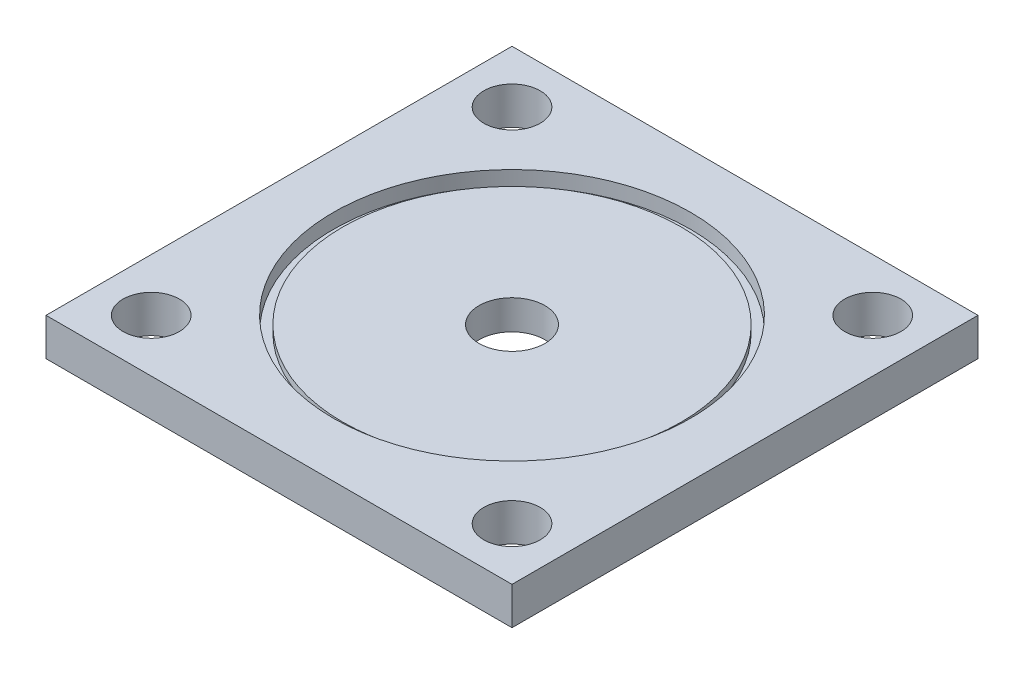
from build123d import *

# Parameters (mm, degrees)
PLATEOUTLINE_W      = 78.74
PLATEOUTLINE_H      = 78.74
BOSS_EXTRUDE1_DEPTH = 6.35
RAILGUIDES_R        = 4.7625
CUT_EXTRUDE1_DEPTH  = 10
CUT_EXTRUDE2_START  = 5
FUELGRAINMOUNTING_R = 30.1625
CUT_EXTRUDE2_DEPTH  = 5
GASINTAKE_R         = 5.55625
CUT_EXTRUDE3_DEPTH  = 5
CUT_EXTRUDE4_START  = 3.857
SKETCH1_R           = 30.1625
SKETCH1_R_2         = 28.575
CUT_EXTRUDE4_DEPTH  = 1.143


with BuildPart() as part:
    # plateOutline → Boss-Extrude1 (new body)
    with BuildSketch(Plane(origin=(0, 0, 0), x_dir=(1, 0, 0), z_dir=(0, 1, 0))):
        Rectangle(PLATEOUTLINE_W, PLATEOUTLINE_H)
    extrude(amount=BOSS_EXTRUDE1_DEPTH)

    # railGuides → Cut-Extrude1 (cut)
    with BuildSketch(Plane(origin=(0, 0, 0), x_dir=(1, 0, 0), z_dir=(0, 1, 0))):
        with Locations((-30.48, 30.48)):
            Circle(RAILGUIDES_R)
        with Locations((30.48, 30.48)):
            Circle(RAILGUIDES_R)
        with Locations((30.48, -30.48)):
            Circle(RAILGUIDES_R)
        with Locations((-30.48, -30.48)):
            Circle(RAILGUIDES_R)
    extrude(amount=CUT_EXTRUDE1_DEPTH, mode=Mode.SUBTRACT)

    # FuelGrainMounting → Cut-Extrude2 (cut)
    with BuildSketch(Plane(origin=(0, 0, 0), x_dir=(1, 0, 0), z_dir=(0, 1, 0)).offset(CUT_EXTRUDE2_START)):
        Circle(FUELGRAINMOUNTING_R)
    extrude(amount=CUT_EXTRUDE2_DEPTH, mode=Mode.SUBTRACT)

    # GasIntake → Cut-Extrude3 (cut)
    with BuildSketch(Plane(origin=(0, 0, 0), x_dir=(1, 0, 0), z_dir=(0, 1, 0))):
        Circle(GASINTAKE_R)
    extrude(amount=CUT_EXTRUDE3_DEPTH, mode=Mode.SUBTRACT)

    # Sketch1 → Cut-Extrude4 (cut)
    with BuildSketch(Plane(origin=(0, 0, 0), x_dir=(1, 0, 0), z_dir=(0, 1, 0)).offset(CUT_EXTRUDE4_START)):
        Circle(SKETCH1_R)
        Circle(SKETCH1_R_2, mode=Mode.SUBTRACT)
    extrude(amount=CUT_EXTRUDE4_DEPTH, mode=Mode.SUBTRACT)


solid = part.part
